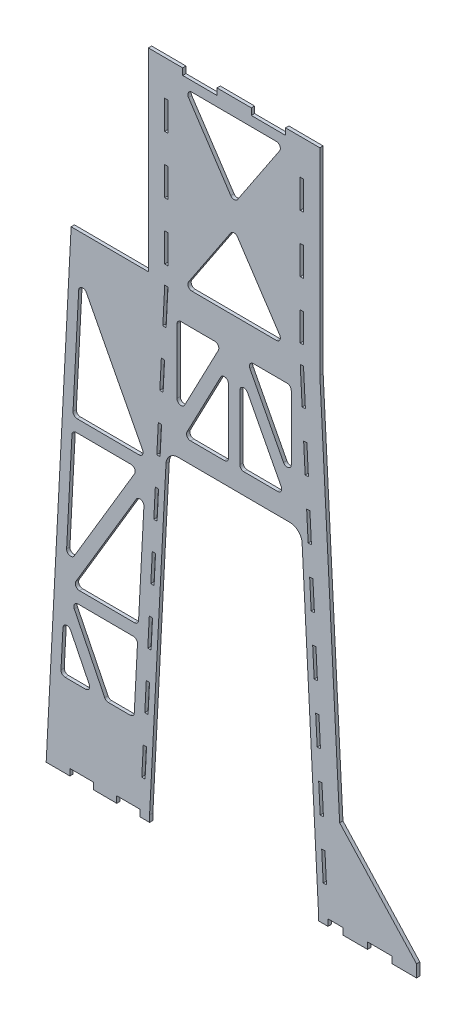
from build123d import *

# Parameters (mm, degrees)
BOSS_EXTRUDE1_DEPTH = 10.16
FILLET1_R           = 12.7
SKETCH5_W           = 76.2
SKETCH5_H           = 20.32
SKETCH5_W_2         = 72.924383382
CUT_EXTRUDE2_DEPTH  = 2152.085241818
CUT_EXTRUDE3_START  = 2034.638365132
CUT_EXTRUDE3_DEPTH  = 20.320018655
FILLET2_R           = 38.1


# Read off the part's stored shape, not the designer's step: Cut-Extrude3
with BuildPart() as part:
    # Sketch3 → Boss-Extrude1 (new body)
    with BuildSketch(Plane(origin=(-0.000535829, 0, 0.117433625), x_dir=(0.9999895904718973, 3.89870025400369e-08, 0.004562778522525134), z_dir=(-0.004562778522525138, 0, 0.9999895904718981))):
        Polygon((158.279986369, 1003.86739505), (211.252837597, 0.56739505), (211.252837597, -19.733109837), (240.571684668, -19.73311098), (516.052837597, -19.73311098), (516.052837597, 18.36688902), (276.918694516, 276.280315243), (215.411932074, 1444.680315243), (215.411932074, 2054.958377525), (-317.886328358, 2054.958377525), (-317.886328358, 1454.840332482), (-558.080959761, 1454.840332482), (-635.729176445, -19.733093734), (-314.171390659, -19.733093734), (-314.171390659, 0.56739505), (-261.198539431, 1003.86739505), align=None)
        Polygon((-590.385734422, 237.576917511), (-581.023126443, 415.376917511), (-492.660023107, 237.576917511), align=None, mode=Mode.SUBTRACT)
        Polygon((-450.114255297, 237.576917511), (-557.712194721, 454.080332482), (-351.043418863, 454.080332482), (-362.444074659, 237.576917511), align=None, mode=Mode.SUBTRACT)
        Polygon((-554.796701248, 492.180332482), (-329.115782661, 870.49568655), (-349.037145724, 492.180332482), align=None, mode=Mode.SUBTRACT)
        Polygon((-574.831164028, 532.964978414), (-554.909800964, 911.280332482), (-349.15024544, 911.280332482), align=None, mode=Mode.SUBTRACT)
        Polygon((-325.965005223, 949.380332482), (-552.903527826, 949.380332482), (-532.172038729, 1343.080332482), align=None, mode=Mode.SUBTRACT)
        Polygon((-228.986328358, 1108.349776157), (-228.986328358, 1372.16739505), (-90.48207844, 1372.16739505), align=None, mode=Mode.SUBTRACT)
        Polygon((-68.966328358, 1067.36739505), (-207.470578277, 1067.36739505), (-68.966328358, 1331.185013943), align=None, mode=Mode.SUBTRACT)
        Polygon((-33.569121839, 1331.629965383), (104.935128079, 1067.81234649), (-33.569121839, 1067.81234649), align=None, mode=Mode.SUBTRACT)
        Polygon((126.450878161, 1108.794727597), (-12.053371758, 1372.61234649), (126.450878161, 1372.61234649), align=None, mode=Mode.SUBTRACT)
        Polygon((-51.237197913, 1703.108696983), (103.618697259, 1470.758377525), (-206.093093085, 1470.758377525), align=None, mode=Mode.SUBTRACT)
        Polygon((-51.237197913, 1771.808058067), (-206.093093085, 2004.158377525), (-51.267725329, 2004.158377525), (103.618697259, 2004.158377525), align=None, mode=Mode.SUBTRACT)
    extrude(amount=BOSS_EXTRUDE1_DEPTH)

    # Fillet1
    fillet1_edges = [part.edges().sort_by_distance(p)[0] for p in [
        (-206.114719837, 1470.75836949, 4.257023344),
        (103.593846553, 1470.758381565, 5.670169649),
        (-51.260445701, 1703.108694985, 4.963596456),
        (103.593825757, 2004.158381565, 5.670169555),
        (-206.114740632, 2004.15836949, 4.257023249),
        (-51.260448379, 1771.80805607, 4.963596443),
        (-574.84891583, 532.964956003, 2.574553361),
        (-349.170361223, 911.28031887, 3.604285342),
        (-554.927774887, 911.280310848, 2.665450061),
        (-581.040809204, 415.376894859, 2.546300828),
        (-590.403312791, 237.576894494, 2.503581353),
        (-492.678618755, 237.576898304, 2.94948213),
        (-450.133293827, 237.576899963, 3.143609046),
        (-362.464025794, 237.576903381, 3.543628663),
        (-351.063497114, 454.080318796, 3.595647292),
        (-557.730121647, 454.080310739, 2.65266344),
        (-349.057246345, 492.180318874, 3.604801465),
        (-329.136105403, 870.495673719, 3.695698165),
        (-554.814660009, 492.180310852, 2.665966184),
        (-325.985363838, 949.380319774, 3.710074451),
        (-532.190266175, 1343.080311734, 2.769197357),
        (-552.921524118, 949.380310926, 2.674604234),
        (126.425793609, 1372.61235142, 5.774347852),
        (-12.077014546, 1372.61234602, 5.142383635),
        (126.425803894, 1108.794732527, 5.774347898),
        (-229.007702674, 1108.34976723, 4.152566647),
        (-90.504904804, 1372.167391523, 4.784530816),
        (-229.007712959, 1372.167386123, 4.1525666),
        (-33.59253906, 1331.629964074, 5.04421204),
        (-33.592528775, 1067.812345181, 5.044212087),
        (104.91027938, 1067.812350581, 5.676176303),
        (-207.492174963, 1067.367386962, 4.250738256),
        (-68.989366809, 1067.367392361, 4.882702473),
        (-68.989377094, 1331.185011254, 4.882702426),
    ]]
    fillet(fillet1_edges, radius=FILLET1_R)

    # Sketch5 → Cut-Extrude2 (cut, through all)
    with BuildSketch(Plane(origin=(-0.046893659, 0, 10.277327864), x_dir=(0.9999895904718981, 0, 0.004562778522525139), z_dir=(-0.004562778522525139, 0, 0.9999895904718982))):
        Polygon((170.449201709, 1332.667603427), (164.556460102, 1444.57324862), (154.396460102, 1444.038242056), (160.289201709, 1332.132596863), align=None)
        Polygon((154.417945031, 1856.661854706), (164.556460102, 1856.660840816), (164.556460102, 1945.560841079), (154.426835368, 1945.56185408), align=None)
        Polygon((154.400164357, 1678.86185596), (164.556460102, 1678.860840292), (164.556460102, 1767.760840554), (154.409054694, 1767.761855333), align=None)
        Polygon((154.382383683, 1501.061857213), (164.556460102, 1501.060839767), (164.556460102, 1589.960840029), (154.39127402, 1589.961856586), align=None)
        Polygon((287.452838367, 0.586898399), (240.796997076, 0.586898399), (240.571685437, -19.733101601), (287.452838367, -19.733101601), align=None)
        with Locations((401.752838367, -9.573101601)):
            Rectangle(SKETCH5_W, SKETCH5_H)
        Polygon((-267.03101662, 1856.660840816), (-256.892501549, 1856.661854706), (-256.901391886, 1945.56185408), (-267.03101662, 1945.560841079), align=None)
        Polygon((-256.87101662, 1444.038242056), (-267.03101662, 1444.57324862), (-272.923758227, 1332.667603427), (-262.763758227, 1332.132596863), align=None)
        with Locations((-379.795807959, -9.592595571)):
            Rectangle(SKETCH5_W_2, SKETCH5_H)
        Polygon((-256.865830538, 1589.961856586), (-267.03101662, 1589.960840029), (-267.03101662, 1501.060839767), (-256.856940201, 1501.061857213), align=None)
        Polygon((-256.883611212, 1767.761855333), (-267.03101662, 1767.760840554), (-267.03101662, 1678.860840292), (-256.874720875, 1678.86185596), align=None)
        with Locations((-525.644574722, -9.592595571)):
            Rectangle(SKETCH5_W_2, SKETCH5_H)
        Polygon((-282.273421078, 1155.113567714), (-272.113421078, 1154.57856115), (-267.438589653, 1243.355579007), (-277.598589653, 1243.890585571), align=None)
        Polygon((-291.62308393, 977.559532001), (-281.46308393, 977.024525437), (-276.788252504, 1065.801543294), (-286.948252504, 1066.336549858), align=None)
        Polygon((225.736841953, 89.254341434), (235.896841953, 89.789347998), (231.222010242, 178.566371292), (221.062010242, 178.031364728), align=None)
        Polygon((216.387178816, 266.808382585), (226.547178816, 267.343389149), (221.87234739, 356.120407005), (211.71234739, 355.585400441), align=None)
        Polygon((207.037515965, 444.362418298), (217.197515965, 444.897424862), (212.522684539, 533.674442718), (202.362684539, 533.139436154), align=None)
        Polygon((197.687853114, 621.916454011), (207.847853114, 622.451460575), (203.173021688, 711.228478431), (193.013021688, 710.693471867), align=None)
        Polygon((188.338190263, 799.470489724), (198.498190263, 800.005496288), (193.823358837, 888.782514145), (183.663358837, 888.247507581), align=None)
        Polygon((178.988527411, 977.024525437), (189.148527411, 977.559532001), (184.473695986, 1066.336549858), (174.313695986, 1065.801543294), align=None)
        Polygon((169.63886456, 1154.57856115), (179.79886456, 1155.113567714), (175.124033135, 1243.890585571), (164.964033135, 1243.355579007), align=None)
        Polygon((-300.972746781, 800.005496288), (-290.812746781, 799.470489724), (-286.137915355, 888.247507581), (-296.297915355, 888.782514145), align=None)
        Polygon((-310.322409632, 622.451460575), (-300.162409632, 621.916454011), (-295.487578206, 710.693471867), (-305.647578206, 711.228478431), align=None)
        Polygon((-319.672072483, 444.897424862), (-309.512072483, 444.362418298), (-304.837241057, 533.139436154), (-314.997241057, 533.674442718), align=None)
        Polygon((-329.021735334, 267.343389149), (-318.861735334, 266.808382585), (-314.186903909, 355.585400441), (-324.346903909, 356.120407005), align=None)
        Polygon((-338.371398472, 89.789347998), (-328.211398472, 89.254341434), (-323.53656676, 178.031364728), (-333.69656676, 178.566371292), align=None)
    extrude(amount=-CUT_EXTRUDE2_DEPTH, mode=Mode.SUBTRACT)

    # Cut-Extrude3 outline → Cut-Extrude3 (cut)
    with BuildSketch(Plane(origin=(0, 0, 0), x_dir=(1, 0, 0), z_dir=(0, 1, 0)).offset(CUT_EXTRUDE3_START)):
        Polygon((108.750532616, -0.61364583), (2.091990648, -0.12698146), (2.045632818, -10.286875699), (108.704174786, -10.773540069), align=None)
        Polygon((-104.61290915, -9.800211328), (-104.56655132, 0.359682911), (-211.225093289, 0.846347282), (-211.271451118, -9.313546958), align=None)
    extrude(amount=CUT_EXTRUDE3_DEPTH, mode=Mode.SUBTRACT)

    # Fillet2
    fillet2_edges = [part.edges().sort_by_distance(p)[0] for p in [
        (158.254584868, 1003.867401221, 5.919577088),
        (-261.219574359, 1003.867384867, 4.00558948),
    ]]
    fillet(fillet2_edges, radius=FILLET2_R)


solid = part.part
